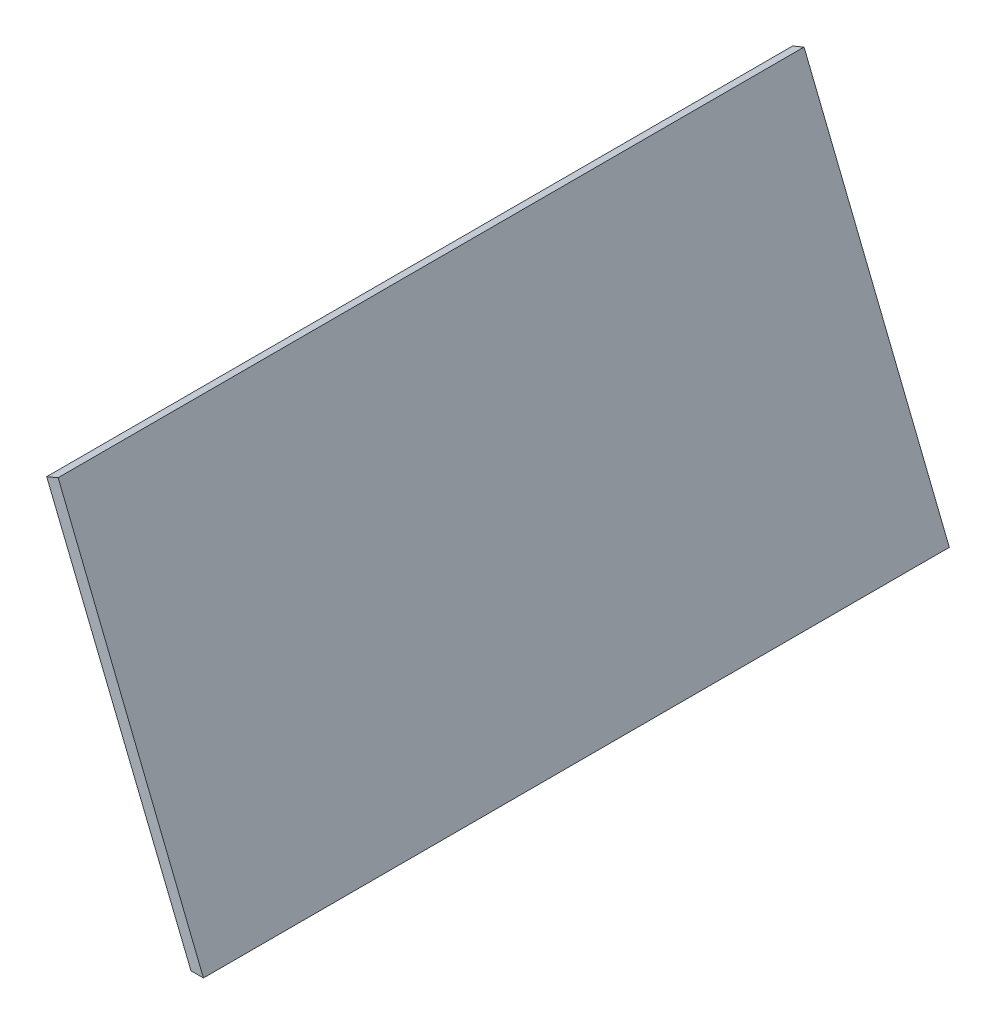
from build123d import *

# Parameters (mm, degrees)
BOSS_EXTRU_1_DEPTH = 600


with BuildPart() as part:
    # Esquisse1 → Boss.-Extru.1 (new body)
    with BuildSketch(Plane.XY):
        Polygon((219.734545737, 127.183031526), (103.65574387, 413.400422848), (112.874448857, 417.275403928), (229.734545737, 127.183031526), align=None)
    extrude(amount=BOSS_EXTRU_1_DEPTH)


solid = part.part
